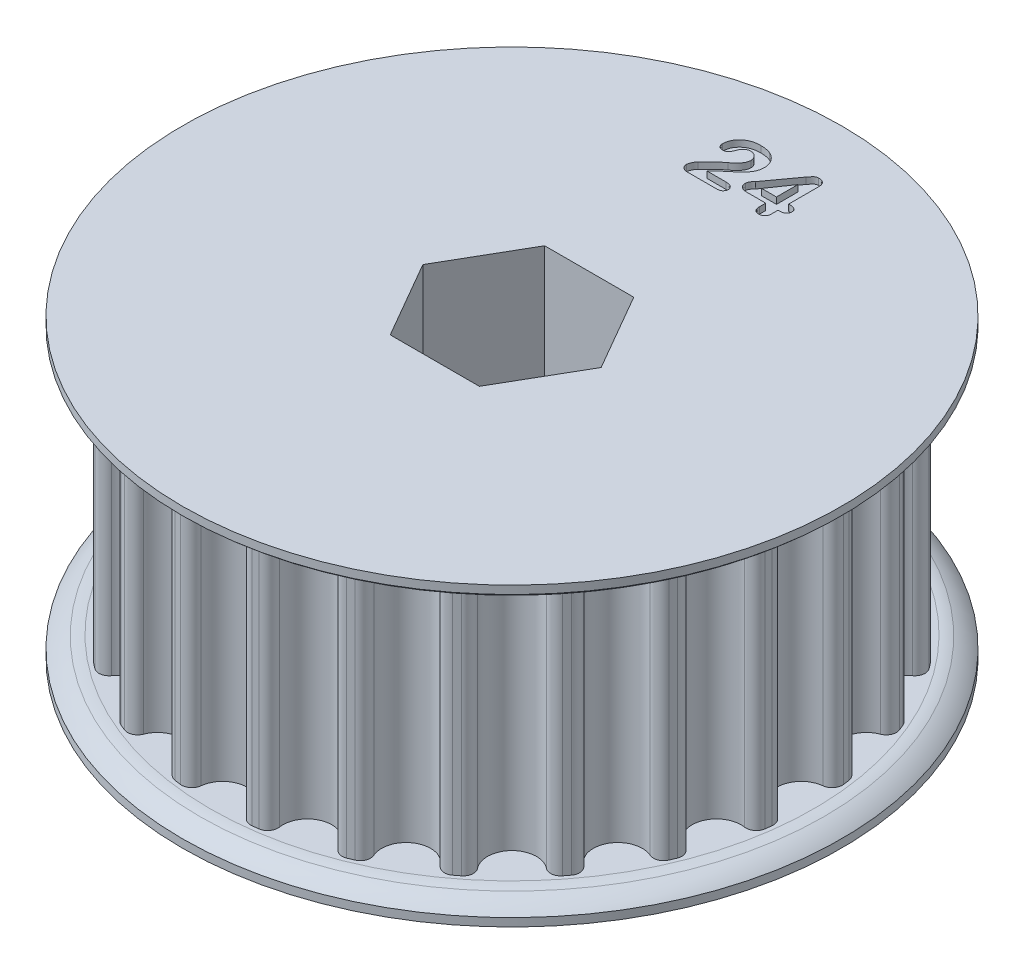
from build123d import *

# Parameters (mm, degrees)
SKETCH1_R               = 18.527092812
TOOTHOD_DEPTH           = 7.9375
TOOTHPROFILE_DEPTH      = 31.635305795
TOOTHPATTERN_COUNT      = 24
BORE_DEPTH              = 31.41244327
BORE_DEPTH_BACK         = 31.41244327
LARGE_TOOTH_COUNT_DEPTH = 0.4


with BuildPart() as part:
    # Sketch1 → ToothOD (new, symmetric)
    with BuildSketch(Plane(origin=(0, 0, 0), x_dir=(1, 0, 0), z_dir=(0, 1, 0))):
        Circle(SKETCH1_R)
    extrude(amount=TOOTHOD_DEPTH, both=True)

    # Sketch2 → ToothProfile (cut, through all)
    with BuildSketch(Plane(origin=(0, 7.9375, 0), x_dir=(1, 0, 0), z_dir=(0, 1, 0))):
        with BuildLine():
            ThreePointArc((-1.51637678, 17.83014695), (0, 16.467092812), (1.51637678, 17.83014695))
            ThreePointArc((1.51637678, 17.83014695), (1.752447858, 18.259636941), (2.224012212, 18.393122023))
            ThreePointArc((2.224012212, 18.393122023), (0, 18.527092812), (-2.224012212, 18.393122023))
            ThreePointArc((-2.224012212, 18.393122023), (-1.752447858, 18.259636941), (-1.51637678, 17.83014695))
        make_face()
    toothprofile = extrude(amount=-TOOTHPROFILE_DEPTH, mode=Mode.SUBTRACT)

    # ToothPattern: ToothProfile ×24 about axis
    toothpattern_axis = Axis((0, 7.9375, 0), (0, -1, 0))
    for i in range(1, TOOTHPATTERN_COUNT):
        add(toothprofile.rotate(toothpattern_axis, i * 360 / TOOTHPATTERN_COUNT), mode=Mode.SUBTRACT)

    # Sketch4 → Flange (revolve)
    with BuildSketch(Plane.XY):
        with BuildLine():
            Line((0, -7.9375), (18.781092812, -7.9375))
            ThreePointArc((18.781092812, -7.9375), (19.106848802, -7.963122571), (19.42666514, -8.030137424))
            ThreePointArc((19.42666514, -8.030137424), (19.994393717, -8.311697125), (20.495592812, -8.6995))
            Line((20.495592812, -8.6995), (20.495592812, -9.2075))
            Line((20.495592812, -9.2075), (0, -9.2075))
            Line((0, -9.2075), (0, -7.9375))
        make_face()
        with BuildLine():
            Line((20.495592812, 9.2075), (20.495592812, 8.6995))
            ThreePointArc((20.495592812, 8.6995), (19.994393717, 8.311697125), (19.42666514, 8.030137424))
            ThreePointArc((19.42666514, 8.030137424), (19.106848802, 7.963122571), (18.781092812, 7.9375))
            Line((18.781092812, 7.9375), (0, 7.9375))
            Line((0, 7.9375), (0, 9.2075))
            Line((0, 9.2075), (20.495592812, 9.2075))
        make_face()
    revolve(axis=Axis((0, 7.858125, 0), (0, -1, 0)))

    # Sketch7 → Bore (cut, two sides: drawn at the far end of the back side and taken through both)
    with BuildSketch(Plane.XZ.offset(-BORE_DEPTH_BACK)):
        Polygon((2.771627702, 4.8006), (-2.771627702, 4.8006), (-5.543255405, 0), (-2.771627702, -4.8006), (2.771627702, -4.8006), (5.543255405, 0), align=None)
    extrude(amount=BORE_DEPTH + BORE_DEPTH_BACK, mode=Mode.SUBTRACT)

    # Sketch9 → Large Tooth Count (cut)
    # profile 1 of 2: a face of its own
    with BuildSketch(Plane(origin=(0, 9.2075, 0), x_dir=(1, 0, 0), z_dir=(0, 1, 0))):
        with BuildLine():
            Line((-1.762125, 13.874923354), (-0.570755859, 13.874923354))
            add(Edge.make_bspline(
                [(-0.570755859, 13.874923354), (-0.533707207, 13.87398852), (-0.463545425, 13.872218156), (-0.365142268, 13.853642303), (-0.279792732, 13.823297538), (-0.208549734, 13.780908725), (-0.152090999, 13.729565586), (-0.111056396, 13.67153727), (-0.085797031, 13.607248318), (-0.082683368, 13.562107058), (-0.081111328, 13.539315932)],
                knots=[0, 0, 0, 0, 1.343135754, 2.543595783, 3.617176489, 4.61442092, 5.531765965, 6.365790276, 7.174912707, 8, 8, 8, 8], degree=3))
            add(Edge.make_bspline(
                [(-0.081111328, 13.539315932), (-0.082203127, 13.518835501), (-0.084392981, 13.477757305), (-0.104097817, 13.41789058), (-0.136223052, 13.361311518), (-0.17989453, 13.308411307), (-0.237387293, 13.262169059), (-0.311315716, 13.230655326), (-0.398880946, 13.211510069), (-0.46199946, 13.209332488), (-0.495597656, 13.208173354)],
                knots=[0, 0, 0, 0, 0.824179157, 1.653080055, 2.512971333, 3.436438535, 4.405072091, 5.457340227, 6.646533722, 8, 8, 8, 8], degree=3))
            Line((-0.495597656, 13.208173354), (-2.305347656, 13.208173354))
            add(Edge.make_bspline(
                [(-2.305347656, 13.208173354), (-2.337708251, 13.209585711), (-2.399445044, 13.212280174), (-2.487124104, 13.233091534), (-2.563929489, 13.269374607), (-2.628936518, 13.319379949), (-2.67994909, 13.379620035), (-2.717611602, 13.44590333), (-2.740998957, 13.517687637), (-2.743747646, 13.567670374), (-2.745134766, 13.592894057)],
                knots=[0, 0, 0, 0, 1.188346208, 2.267099395, 3.286301641, 4.287122075, 5.25691743, 6.166969209, 7.074964888, 8, 8, 8, 8], degree=3))
            add(Edge.make_bspline(
                [(-2.745134766, 13.592894057), (-2.744179889, 13.610580586), (-2.742139185, 13.648379169), (-2.72704257, 13.70774883), (-2.70583681, 13.773882187), (-2.675402152, 13.84383634), (-2.641188782, 13.913947291), (-2.603506466, 13.978442241), (-2.564081929, 14.035353764), (-2.534629659, 14.068174532), (-2.520404297, 14.08402687)],
                knots=[0, 0, 0, 0, 0.772497252, 1.650934469, 2.665768415, 3.807487169, 4.98083678, 6.074173258, 7.069831195, 8, 8, 8, 8], degree=3))
            add(Edge.make_bspline(
                [(-2.520404297, 14.08402687), (-2.466053132, 14.139560567), (-2.361152933, 14.246743107), (-2.205832985, 14.398276917), (-2.061164397, 14.53766544), (-1.945964026, 14.644447116), (-1.859956155, 14.722642098), (-1.801130055, 14.774408415), (-1.747617549, 14.821952202), (-1.697550942, 14.863044242), (-1.653169438, 14.900631234), (-1.612941668, 14.932596807), (-1.57736698, 14.959631323), (-1.554570298, 14.975096179), (-1.544091797, 14.982204604)],
                knots=[0, 0, 0, 0, 2.106460972, 4.065564631, 5.88232778, 7.552435621, 8.323665149, 9.033433807, 9.676767744, 10.26395234, 10.78914621, 11.253325952, 11.656791058, 12, 12, 12, 12], degree=3))
            add(Edge.make_bspline(
                [(-1.544091797, 14.982204604), (-1.512150488, 15.005011085), (-1.450036186, 15.049361449), (-1.362910525, 15.118140765), (-1.285488552, 15.187837086), (-1.215517545, 15.256252343), (-1.154259094, 15.325580203), (-1.101287219, 15.395509388), (-1.056278481, 15.465940278), (-1.018709146, 15.536455299), (-0.990117065, 15.607242181), (-0.96741796, 15.676560053), (-0.955657973, 15.745542042), (-0.953540426, 15.791049996), (-0.9525, 15.813409682)],
                knots=[0, 0, 0, 0, 1.334834965, 2.595771614, 3.772830874, 4.876488071, 5.92253324, 6.916378838, 7.85720954, 8.762924605, 9.629317751, 10.451189837, 11.239014127, 12, 12, 12, 12], degree=3))
            add(Edge.make_bspline(
                [(-0.9525, 15.813409682), (-0.95336502, 15.836539529), (-0.955052845, 15.881670448), (-0.968117239, 15.947580681), (-0.9896362, 16.009855495), (-1.020438978, 16.067574181), (-1.05762368, 16.12085656), (-1.101737406, 16.167955458), (-1.152277568, 16.208477239), (-1.208116574, 16.24252049), (-1.268172163, 16.270290822), (-1.332096405, 16.289379526), (-1.398736756, 16.301965511), (-1.444318349, 16.303181428), (-1.467445313, 16.303798354)],
                knots=[0, 0, 0, 0, 1.048524963, 2.045880207, 3.035079073, 4.026514865, 5.003545842, 5.974663832, 6.942844473, 7.932746918, 8.934660944, 9.934741294, 10.952139253, 12, 12, 12, 12], degree=3))
            add(Edge.make_bspline(
                [(-1.467445313, 16.303798354), (-1.488603837, 16.303246673), (-1.530328923, 16.302158745), (-1.591038054, 16.288605382), (-1.649193485, 16.268537667), (-1.704582037, 16.24000902), (-1.757128938, 16.202914471), (-1.806805489, 16.158002476), (-1.854552156, 16.105553337), (-1.88191115, 16.065543697), (-1.896070313, 16.044837416)],
                knots=[0, 0, 0, 0, 0.968576666, 1.910054901, 2.83824492, 3.784521401, 4.756498814, 5.779585462, 6.850863807, 8, 8, 8, 8], degree=3))
            add(Edge.make_bspline(
                [(-1.896070313, 16.044837416), (-1.898884837, 16.039169206), (-1.90725541, 16.022311594), (-1.919621651, 15.986084258), (-1.941429436, 15.932681203), (-1.964571994, 15.863127936), (-1.994294675, 15.788413168), (-2.02891906, 15.716314224), (-2.069030563, 15.652017002), (-2.110038336, 15.592107905), (-2.163240409, 15.542668437), (-2.230788188, 15.508340165), (-2.311915747, 15.488389198), (-2.370213456, 15.486338596), (-2.401341797, 15.485243666)],
                knots=[0, 0, 0, 0, 0.277128514, 0.824197545, 1.674066046, 2.805212172, 4.034469565, 5.196326461, 6.303667431, 7.353778336, 8.369399301, 9.448751033, 10.637748383, 12, 12, 12, 12], degree=3))
            add(Edge.make_bspline(
                [(-2.401341797, 15.485243666), (-2.424271026, 15.486353646), (-2.469130374, 15.488525239), (-2.533582425, 15.506574301), (-2.591105186, 15.538155264), (-2.642025052, 15.579899622), (-2.684486339, 15.632087381), (-2.713078119, 15.694699146), (-2.731809009, 15.76445846), (-2.73372109, 15.813773847), (-2.734716797, 15.839454604)],
                knots=[0, 0, 0, 0, 1.006577142, 1.969294067, 2.910545259, 3.870728958, 4.847838899, 5.837573602, 6.873926541, 8, 8, 8, 8], degree=3))
            add(Edge.make_bspline(
                [(-2.734716797, 15.839454604), (-2.733654173, 15.870272421), (-2.731508455, 15.932501712), (-2.715647187, 16.02641007), (-2.691165523, 16.121886301), (-2.656366941, 16.218238432), (-2.61099031, 16.312760147), (-2.556929288, 16.404438131), (-2.490968298, 16.489845053), (-2.417939183, 16.572390484), (-2.333218402, 16.647662124), (-2.237995489, 16.715825835), (-2.132080587, 16.775743586), (-2.016058379, 16.828333575), (-1.889529964, 16.870768082), (-1.752593036, 16.900820117), (-1.60590276, 16.920010724), (-1.504715272, 16.921932735), (-1.4525625, 16.922923354)],
                knots=[0, 0, 0, 0, 0.79066067, 1.596552158, 2.438066046, 3.318094126, 4.22076533, 5.12585777, 6.043865989, 6.985993145, 7.950839248, 8.945468985, 9.986194989, 11.068910188, 12.21037173, 13.404260134, 14.66213667, 16, 16, 16, 16], degree=3))
            add(Edge.make_bspline(
                [(-1.4525625, 16.922923354), (-1.419313755, 16.922468154), (-1.354251016, 16.921577398), (-1.258683499, 16.915382026), (-1.167205964, 16.906195634), (-1.079873649, 16.891678454), (-0.996460634, 16.874347587), (-0.917374073, 16.851581312), (-0.842094469, 16.826080755), (-0.794362208, 16.805187832), (-0.770929688, 16.794931166)],
                knots=[0, 0, 0, 0, 1.141710532, 2.234153931, 3.287715026, 4.297387598, 5.273071892, 6.211454997, 7.121975032, 8, 8, 8, 8], degree=3))
            add(Edge.make_bspline(
                [(-0.770929688, 16.794931166), (-0.737844503, 16.778689088), (-0.67280231, 16.746758773), (-0.5825276, 16.688840779), (-0.500121613, 16.625023812), (-0.427116332, 16.553849783), (-0.362358815, 16.477519254), (-0.304287189, 16.397223162), (-0.256045848, 16.310722103), (-0.215247684, 16.220671783), (-0.183300557, 16.127674135), (-0.160232052, 16.033549748), (-0.145256758, 15.938657135), (-0.143668356, 15.874980009), (-0.142875, 15.843175307)],
                knots=[0, 0, 0, 0, 1.100471427, 2.163417708, 3.198242748, 4.209796447, 5.203380146, 6.186404149, 7.165424876, 8.157237974, 9.136931722, 10.098602738, 11.050312444, 12, 12, 12, 12], degree=3))
            add(Edge.make_bspline(
                [(-0.142875, 15.843175307), (-0.144693042, 15.793175923), (-0.148288338, 15.69429892), (-0.1782964, 15.549150428), (-0.227637669, 15.410508707), (-0.295917887, 15.281042845), (-0.373499735, 15.162518378), (-0.451858766, 15.054395038), (-0.532509928, 14.961301112), (-0.602079602, 14.891836904), (-0.661927162, 14.839944468), (-0.71198559, 14.7964842), (-0.768326496, 14.748400074), (-0.831144563, 14.695093673), (-0.901057651, 14.637601356), (-0.976718868, 14.574007501), (-1.059338558, 14.506612059), (-1.146105933, 14.435918207), (-1.233051854, 14.364971252), (-1.314376052, 14.294877474), (-1.389833251, 14.229756169), (-1.4579485, 14.16759103), (-1.519166092, 14.108979255), (-1.574924824, 14.055043739), (-1.622231717, 14.003363641), (-1.651539483, 13.970210491), (-1.665386719, 13.954546401)],
                knots=[0, 0, 0, 0, 1.436599664, 2.840968415, 4.241909903, 5.655071448, 7.037977016, 8.313294046, 9.491515882, 10.57584574, 11.13676856, 11.768818006, 12.482089669, 13.266552005, 14.137751607, 15.08474532, 16.108481255, 17.203478555, 18.302996106, 19.33499709, 20.290440541, 21.168908746, 21.986178864, 22.727567017, 23.398805086, 24, 24, 24, 24], degree=3))
            add(Edge.make_bspline(
                [(-1.665386719, 13.954546401), (-1.67937404, 13.940422035), (-1.708903168, 13.910603585), (-1.743772519, 13.887226966), (-1.762125, 13.874923354)],
                knots=[0, 0, 0, 0, 0.947357495, 2, 2, 2, 2], degree=3))
        make_face()
    # profile 2 of 2: a face of its own
    with BuildSketch(Plane(origin=(0, 9.2075, 0), x_dir=(1, 0, 0), z_dir=(0, 1, 0))):
        with BuildLine():
            Line((1.80975, 13.57205812), (1.80975, 13.970173354))
            Line((1.80975, 13.970173354), (0.619869141, 13.970173354))
            add(Edge.make_bspline(
                [(0.619869141, 13.970173354), (0.580060758, 13.971403671), (0.504941434, 13.973725308), (0.399612197, 13.996090669), (0.308880244, 14.033115717), (0.23378811, 14.085812823), (0.17508516, 14.151988241), (0.133437098, 14.229970132), (0.10835603, 14.318895519), (0.105607633, 14.381762437), (0.104179687, 14.414425307)],
                knots=[0, 0, 0, 0, 1.235632246, 2.331666144, 3.326551879, 4.26108804, 5.156571119, 6.049762469, 6.986742861, 8, 8, 8, 8], degree=3))
            add(Edge.make_bspline(
                [(0.104179687, 14.414425307), (0.105289172, 14.433114237), (0.107509704, 14.470518428), (0.122419508, 14.526129119), (0.147167558, 14.580869087), (0.179036368, 14.635560089), (0.215302384, 14.689306119), (0.25135614, 14.741112543), (0.289579198, 14.787228319), (0.320714153, 14.809383915), (0.335607422, 14.819981948)],
                knots=[0, 0, 0, 0, 0.934046921, 1.869409865, 2.857765983, 3.929780272, 5.03031677, 6.097010855, 7.089713464, 8, 8, 8, 8], degree=3))
            Line((0.335607422, 14.819981948), (1.651248047, 16.621546401))
            add(Edge.make_bspline(
                [(1.651248047, 16.621546401), (1.672010519, 16.648881627), (1.711234249, 16.700522373), (1.767714004, 16.772663235), (1.822009689, 16.831716756), (1.870160875, 16.883110849), (1.920681279, 16.922964131), (1.975738138, 16.950772198), (2.036178991, 16.968047896), (2.078265746, 16.969697731), (2.099964844, 16.970548354)],
                knots=[0, 0, 0, 0, 1.390535219, 2.626950083, 3.70828158, 4.638957612, 5.476950978, 6.2991977, 7.123100014, 8, 8, 8, 8], degree=3))
            add(Edge.make_bspline(
                [(2.099964844, 16.970548354), (2.13705427, 16.969336942), (2.206795717, 16.967059051), (2.304346604, 16.944598379), (2.387634601, 16.907278175), (2.456764895, 16.854289239), (2.509498976, 16.784732269), (2.545716375, 16.700469053), (2.568239945, 16.602120184), (2.570534386, 16.53163958), (2.57175, 16.494298354)],
                knots=[0, 0, 0, 0, 1.157280306, 2.176102794, 3.10543489, 3.989019352, 4.867867339, 5.801068714, 6.834987425, 8, 8, 8, 8], degree=3))
            Line((2.57175, 16.494298354), (2.57175, 14.636923354))
            Line((2.57175, 14.636923354), (2.582912109, 14.636923354))
            add(Edge.make_bspline(
                [(2.582912109, 14.636923354), (2.617924258, 14.636065837), (2.685216537, 14.634417717), (2.781812648, 14.621940711), (2.869557987, 14.600535638), (2.936312595, 14.575122127), (2.983929001, 14.549709201), (3.014450043, 14.526162175), (3.039856687, 14.498307119), (3.060925202, 14.466683228), (3.077481221, 14.4310748), (3.089348767, 14.391514804), (3.095942938, 14.347673898), (3.096711941, 14.317213236), (3.097113281, 14.301315932)],
                knots=[0, 0, 0, 0, 1.802451844, 3.464257327, 5.003774423, 6.443421813, 7.129422606, 7.775755855, 8.417530271, 9.062220993, 9.725001742, 10.432079129, 11.18170803, 12, 12, 12, 12], degree=3))
            add(Edge.make_bspline(
                [(3.097113281, 14.301315932), (3.095830305, 14.276322207), (3.093360426, 14.228206362), (3.070041776, 14.16022645), (3.031199296, 14.101469388), (2.976466978, 14.053194168), (2.908290931, 14.014974546), (2.826064331, 13.988839764), (2.730902807, 13.972469046), (2.662858996, 13.970968296), (2.626816406, 13.970173354)],
                knots=[0, 0, 0, 0, 0.921198297, 1.773414562, 2.619992516, 3.496174365, 4.444384562, 5.487890538, 6.669343599, 8, 8, 8, 8], degree=3))
            Line((2.626816406, 13.970173354), (2.57175, 13.970173354))
            Line((2.57175, 13.970173354), (2.57175, 13.57205812))
            add(Edge.make_bspline(
                [(2.57175, 13.57205812), (2.570493079, 13.542190649), (2.568075869, 13.48475191), (2.548897186, 13.403189858), (2.515373835, 13.331314227), (2.469227361, 13.269601199), (2.409826926, 13.220201725), (2.338875555, 13.184768105), (2.256439724, 13.163621702), (2.197828006, 13.161609079), (2.1669375, 13.160548354)],
                knots=[0, 0, 0, 0, 1.0944165, 2.104694591, 3.048606635, 3.98353806, 4.906941791, 5.854614282, 6.869303732, 8, 8, 8, 8], degree=3))
            add(Edge.make_bspline(
                [(2.1669375, 13.160548354), (2.141487065, 13.161720399), (2.092205775, 13.163989903), (2.022479486, 13.184787365), (1.960074169, 13.218366241), (1.906406549, 13.265636294), (1.862355416, 13.325606431), (1.831223124, 13.397781516), (1.812444465, 13.48131692), (1.81068122, 13.540697541), (1.80975, 13.57205812)],
                knots=[0, 0, 0, 0, 0.990459393, 1.917889281, 2.809520501, 3.734930502, 4.682914796, 5.687630184, 6.778772386, 8, 8, 8, 8], degree=3))
        make_face()
        Polygon((0.89296875, 14.636923354), (1.80975, 14.636923354), (1.80975, 15.970423354), align=None, mode=Mode.SUBTRACT)
    extrude(amount=-LARGE_TOOTH_COUNT_DEPTH, mode=Mode.SUBTRACT)


solid = part.part
